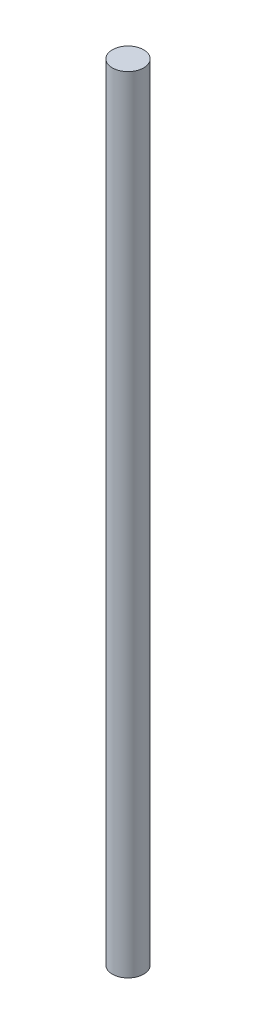
from build123d import *

# Parameters (mm, degrees)
ESBO_O1_W = 31.75
ESBO_O1_H = 1590


with BuildPart() as part:
    # Esboço1 → Revolução1 (revolve)
    with BuildSketch(Plane.XY):
        with Locations((15.875, 795)):
            Rectangle(ESBO_O1_W, ESBO_O1_H)
    revolve(axis=Axis((0, 0, 0), (0, 1, 0)))


solid = part.part
